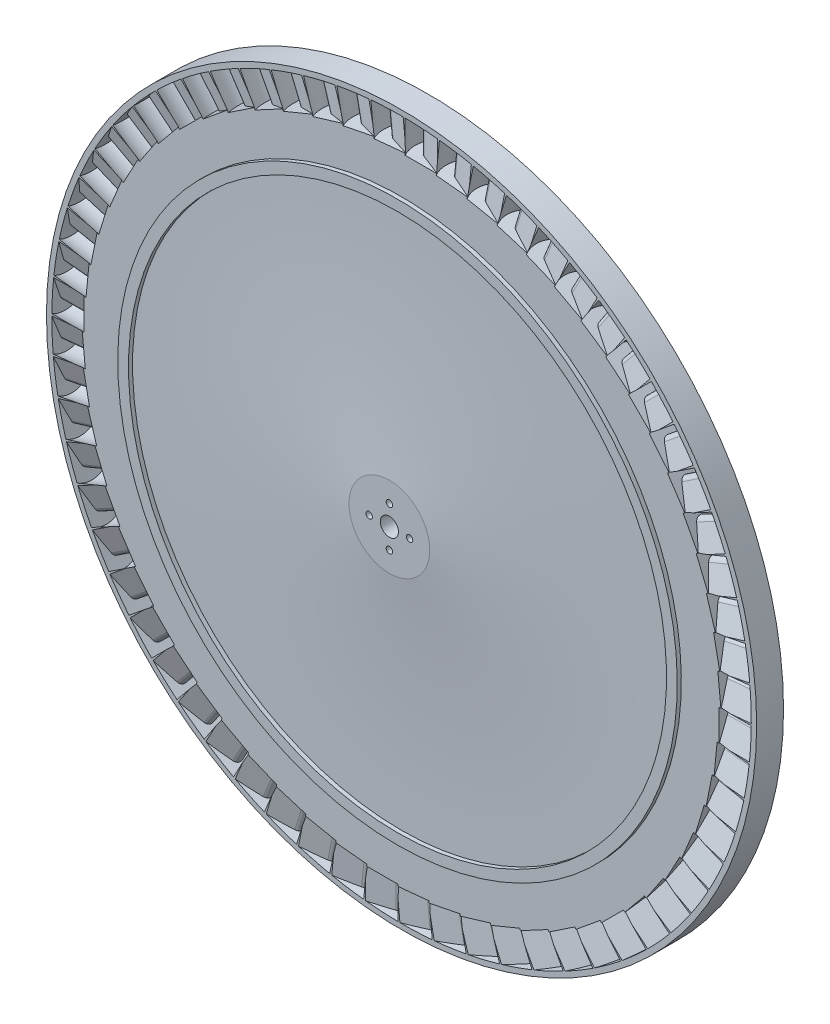
from build123d import *

# Parameters (mm, degrees)
CUT_EXTRUDE1_DEPTH      = 185.094338932
CUT_EXTRUDE1_DEPTH_BACK = 185.094338932
SKETCH2_R               = 1.190625
SKETCH2_R_2             = 3.3782
CUT_EXTRUDE2_START      = -12
CUT_EXTRUDE2_DEPTH      = 303.844848032
CIRPATTERN1_COUNT       = 64
SKETCH1_3_W             = 2
SKETCH1_3_H             = 10


with BuildPart() as part:
    # Sketch1 → Revolve1 (revolve)
    with BuildSketch(Plane.YZ):
        with BuildLine():
            Line((0, -9.525), (0, 9.525))
            Line((0, 9.525), (-15, 9.525))
            ThreePointArc((-15, 9.525), (-57.439820181, 6.132050356), (-100, 5))
            Line((-100, 5), (-100, 6.5))
            Line((-100, 6.5), (-104, 6.5))
            Line((-104, 6.5), (-104, 5))
            Line((-104, 5), (-130, 5))
            Line((-130, 5), (-130, -5))
            Line((-130, -5), (-104, -5))
            Line((-104, -5), (-104, -6.5))
            Line((-104, -6.5), (-100, -6.5))
            Line((-100, -6.5), (-100, -5))
            ThreePointArc((-100, -5), (-57.439820181, -6.132050356), (-15, -9.525))
            Line((-15, -9.525), (0, -9.525))
        make_face()
    revolve(axis=Axis((0, 0, 9.525), (0, 0, -1)))

    # Sketch2 → Cut-Extrude1 (cut, two sides: drawn at the far end of the back side and taken through both)
    with BuildSketch(Plane(origin=(0, 0, 0), x_dir=(0, 1, 0), z_dir=(0, 0, 1)).offset(-CUT_EXTRUDE1_DEPTH_BACK)):
        with Locations((0, 7.5)):
            Circle(SKETCH2_R)
        with Locations((-7.5, 0)):
            Circle(SKETCH2_R)
        with Locations((0, -7.5)):
            Circle(SKETCH2_R)
        with Locations((7.5, 0)):
            Circle(SKETCH2_R)
        Circle(SKETCH2_R_2)
    extrude(amount=CUT_EXTRUDE1_DEPTH + CUT_EXTRUDE1_DEPTH_BACK, mode=Mode.SUBTRACT)

    # Sketch4 → Cut-Extrude2 (cut)
    with BuildSketch(Plane.YZ.offset(130).offset(CUT_EXTRUDE2_START)):
        with BuildLine():
            ThreePointArc((-1.339745962, -5), (0, 0), (-1.339745962, 5))
            Line((-1.339745962, 5), (-13.339745962, 5))
            Line((-13.339745962, 5), (-5.275159206, 1.864029459))
            ThreePointArc((-5.275159206, 1.864029459), (-4, 0), (-5.275159206, -1.864029459))
            Line((-5.275159206, -1.864029459), (-13.339745962, -5))
            Line((-13.339745962, -5), (-1.339745962, -5))
        make_face()
    cut_extrude2 = extrude(amount=CUT_EXTRUDE2_DEPTH, mode=Mode.SUBTRACT)

    # CirPattern1: Cut-Extrude2 ×64 about axis
    cirpattern1_axis = Axis((0, 0, 10.4775), (0, 0, -1))
    for i in range(1, CIRPATTERN1_COUNT):
        add(cut_extrude2.rotate(cirpattern1_axis, i * 360 / CIRPATTERN1_COUNT), mode=Mode.SUBTRACT)

    # Sketch1<3> → Revolve3 (revolve)
    with BuildSketch(Plane.YZ):
        with Locations((-131, 0)):
            Rectangle(SKETCH1_3_W, SKETCH1_3_H)
    revolve(axis=Axis((0, 0, 10.4775), (0, 0, -1)))


solid = part.part
